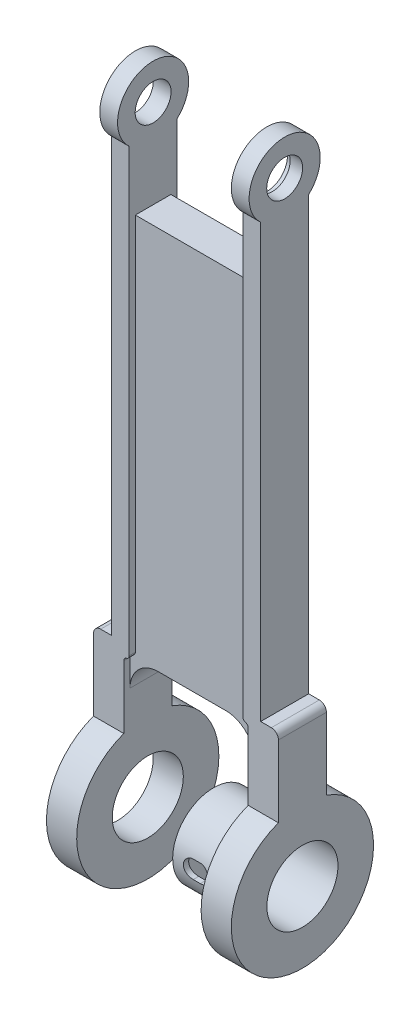
from build123d import *
from build123d.topology import SkipClean

# Parameters (mm, degrees)
SALIENTE_EXTRUIR1_DEPTH    = 10
SALIENTE_EXTRUIR2_DEPTH    = 10
SALIENTE_EXTRUIR3_DEPTH    = 10
SALIENTE_EXTRUIR4_DEPTH    = 1.75
SALIENTE_EXTRUIR5_START    = 1.75
SALIENTE_EXTRUIR5_DEPTH    = 1.75
CROQUIS26_W                = 5
CROQUIS26_H                = 35
SALIENTE_EXTRUIR6_DEPTH    = 1.75
CROQUIS27_W                = 5
CROQUIS27_H                = 35
SALIENTE_EXTRUIR7_DEPTH    = 11.75
CORTAR_EXTRUIR3_DEPTH      = 205.699932829
CORTAR_EXTRUIR3_DEPTH_BACK = 99.75
SALIENTE_EXTRUIR8_START    = -5
SALIENTE_EXTRUIR8_DEPTH    = 5
CROQUIS29_R                = 10
SALIENTE_EXTRUIR9_DEPTH    = 5
CORTAR_EXTRUIR5_DEPTH      = 206.22487666
CORTAR_EXTRUIR5_DEPTH_BACK = 206.22487666
SALIENTE_EXTRUIR11_START   = -8.5
CROQUIS32_R                = 20
SALIENTE_EXTRUIR11_DEPTH   = 8.5
CROQUIS33_R                = 20
SALIENTE_EXTRUIR12_DEPTH   = 8.5
CROQUIS34_R                = 5.05
CORTAR_EXTRUIR6_DEPTH      = 90
CROQUIS39_R                = 5.78
CORTAR_EXTRUIR7_DEPTH      = 1.5
CROQUIS41_R                = 10
CORTAR_EXTRUIR8_DEPTH      = 43
CROQUIS42_R                = 4
CORTAR_EXTRUIR9_DEPTH      = 27
CROQUIS43_R                = 10
CORTAR_EXTRUIR10_DEPTH     = 12
CROQUIS45_R                = 11.5
SALIENTE_EXTRUIR13_DEPTH   = 16.5
REDONDEO1_R                = 2
CROQUIS48_R                = 10
CORTAR_EXTRUIR12_DEPTH     = 17
SALIENTE_EXTRUIR16_DEPTH   = 6
CORTAR_EXTRUIR23_START     = -13
CORTAR_EXTRUIR23_DEPTH     = 13
SALIENTE_EXTRUIR17_START   = -25
CROQUIS54_R                = 11.5
SALIENTE_EXTRUIR17_DEPTH   = 25
CROQUIS57_R                = 10
CORTAR_EXTRUIR26_DEPTH     = 23
CROQUIS58_R                = 4
CORTAR_EXTRUIR27_DEPTH     = 23
SALIENTE_EXTRUIR18_DEPTH   = 7.5
SALIENTE_EXTRUIR18_2_DEPTH = 7.5
CORTAR_EXTRUIR28_DEPTH     = 7.5
CORTAR_EXTRUIR30_START     = -2.643019
CORTAR_EXTRUIR30_DEPTH     = 2.643019
CORTAR_EXTRUIR33_START     = -6.139862392
CORTAR_EXTRUIR33_DEPTH     = 6.139862392
CORTAR_EXTRUIR34_START     = -35.822321
CORTAR_EXTRUIR34_DEPTH     = 40


# Read off the part's stored shape, not the designer's step: Cortar-Extruir33
with BuildPart() as part:
    # Croquis1 → Saliente-Extruir1 (new body)
    with BuildSketch(Plane.XY):
        Polygon((0, -143), (0, -35), (-1.6, -35), (-37.4, -35), (-42, -35), (-42, -143), align=None)
    extrude(amount=-SALIENTE_EXTRUIR1_DEPTH)

    # Croquis3 → Saliente-Extruir2 (add)
    with BuildSketch(Plane.XY):
        with BuildLine():
            Line((-47, -141), (-47, -145))
            Line((-47, -145), (-47, -160))
            Line((-47, -160), (-47, -180))
            Line((-47, -180), (-47, -200))
            Line((-47, -200), (-38.5, -200))
            Line((-38.5, -200), (-38.5, -151))
            Line((-38.5, -151), (-38.5, -143))
            Line((-38.5, -143), (-42, -143))
            Line((-42, -143), (-42, -139))
            Line((-42, -139), (-45, -139))
            ThreePointArc((-45, -139), (-46.414213562, -139.585786438), (-47, -141))
        make_face()
        with BuildLine():
            Line((0, -143), (-11.5, -143))
            ThreePointArc((-11.5, -143), (-5.843145751, -145.343145751), (-3.5, -151))
            Line((-3.5, -151), (-3.5, -200))
            Line((-3.5, -200), (5, -200))
            Line((5, -200), (5, -143))
            Line((5, -143), (5, -141))
            ThreePointArc((5, -141), (4.414213562, -139.585786438), (3, -139))
            Line((3, -139), (0, -139))
            Line((0, -139), (0, -143))
        make_face()
    extrude(amount=-SALIENTE_EXTRUIR2_DEPTH)

    # Croquis21 → Saliente-Extruir3 (add)
    with BuildSketch(Plane.XY):
        with BuildLine():
            Line((-38.5, -143), (-38.5, -151))
            ThreePointArc((-38.5, -151), (-36.156854249, -145.343145751), (-30.5, -143))
            Line((-30.5, -143), (-38.5, -143))
        make_face()
    extrude(amount=-SALIENTE_EXTRUIR3_DEPTH)

    # Croquis22 → Saliente-Extruir4 (add)
    with BuildSketch(Plane(origin=(0, 0, -10), x_dir=(-1, 0, 0), z_dir=(0, 0, -1))):
        with BuildLine():
            Line((3.5, -200), (3.5, -156.87358131))
            Line((3.5, -156.87358131), (3.5, -151))
            Line((3.5, -151), (3.5, -141.333778868))
            ThreePointArc((3.5, -141.333778868), (3.709430585, -140.721406432), (4.25, -140.365533031))
            ThreePointArc((4.25, -140.365533031), (4.790569415, -140.00965963), (5, -139.397287194))
            Line((5, -139.397287194), (5, -35))
            Line((5, -35), (0, -35))
            Line((0, -35), (0, -139))
            Line((0, -139), (-3, -139))
            ThreePointArc((-3, -139), (-4.414213562, -139.585786438), (-5, -141))
            Line((-5, -141), (-5, -200))
            Line((-5, -200), (3.5, -200))
        make_face()
        with BuildLine():
            Line((42, -35), (37, -35))
            Line((37, -35), (37, -139.397287194))
            ThreePointArc((37, -139.397287194), (37.209430585, -140.00965963), (37.75, -140.365533031))
            ThreePointArc((37.75, -140.365533031), (38.290569415, -140.721406432), (38.5, -141.333778868))
            Line((38.5, -141.333778868), (38.5, -151))
            Line((38.5, -151), (38.5, -155.512462497))
            Line((38.5, -155.512462497), (38.5, -200))
            Line((38.5, -200), (47, -200))
            Line((47, -200), (47, -141))
            ThreePointArc((47, -141), (46.414213562, -139.585786438), (45, -139))
            Line((45, -139), (42, -139))
            Line((42, -139), (42, -35))
        make_face()
    extrude(amount=SALIENTE_EXTRUIR4_DEPTH)

    # Croquis24 → Saliente-Extruir5 (add)
    with BuildSketch(Plane.XY.offset(SALIENTE_EXTRUIR5_START)):
        with BuildLine():
            Line((-37, -141.498649254), (-37, -35))
            Line((-37, -35), (-42, -35))
            Line((-42, -35), (-42, -139))
            Line((-42, -139), (-45, -139))
            ThreePointArc((-45, -139), (-46.414213562, -139.585786438), (-47, -141))
            Line((-47, -141), (-47, -200))
            Line((-47, -200), (-38.5, -200))
            Line((-38.5, -200), (-38.5, -143.435140927))
            ThreePointArc((-38.5, -143.435140927), (-38.290569415, -142.822768491), (-37.75, -142.466895091))
            ThreePointArc((-37.75, -142.466895091), (-37.209430585, -142.11102169), (-37, -141.498649254))
        make_face()
        with BuildLine():
            Line((0, -35), (-5, -35))
            Line((-5, -35), (-5, -140.397287194))
            ThreePointArc((-5, -140.397287194), (-4.790569415, -141.00965963), (-4.25, -141.365533031))
            ThreePointArc((-4.25, -141.365533031), (-3.709430585, -141.721406432), (-3.5, -142.333778868))
            Line((-3.5, -142.333778868), (-3.5, -200))
            Line((-3.5, -200), (5, -200))
            Line((5, -200), (5, -141))
            ThreePointArc((5, -141), (4.414213562, -139.585786438), (3, -139))
            Line((3, -139), (0, -139))
            Line((0, -139), (0, -35))
        make_face()
    extrude(amount=-SALIENTE_EXTRUIR5_DEPTH)

    # Croquis26 → Saliente-Extruir6 (add)
    with BuildSketch(Plane.XY):
        with Locations((-39.5, -17.5)):
            Rectangle(CROQUIS26_W, CROQUIS26_H)
        with Locations((-2.5, -17.5)):
            Rectangle(CROQUIS26_W, CROQUIS26_H)
    extrude(amount=SALIENTE_EXTRUIR6_DEPTH)

    # Croquis27 → Saliente-Extruir7 (add)
    with BuildSketch(Plane(origin=(0, 0, 0), x_dir=(-1, 0, 0), z_dir=(0, 0, -1))):
        with Locations((2.5, -17.5)):
            Rectangle(CROQUIS27_W, CROQUIS27_H)
        with Locations((39.5, -17.5)):
            Rectangle(CROQUIS27_W, CROQUIS27_H)
    extrude(amount=SALIENTE_EXTRUIR7_DEPTH)

    # Croquis28 → Cortar-Extruir3 (cut, two sides: drawn at the far end of the back side and taken through both)
    with BuildSketch(Plane.ZY.offset(5).offset(-CORTAR_EXTRUIR3_DEPTH_BACK)):
        with BuildLine():
            ThreePointArc((-11.75, -2.621822718), (-8.62065099, -0.678471884), (-5, 0))
            Line((-5, 0), (-11.75, 0))
            Line((-11.75, 0), (-11.75, -2.621822718))
        make_face()
        with BuildLine():
            Line((1.75, -2.621822718), (1.75, 0))
            Line((1.75, 0), (-5, 0))
            ThreePointArc((-5, 0), (-1.37934901, -0.678471884), (1.75, -2.621822718))
        make_face()
    extrude(amount=CORTAR_EXTRUIR3_DEPTH + CORTAR_EXTRUIR3_DEPTH_BACK, mode=Mode.SUBTRACT)

    # Croquis28<5> → Saliente-Extruir8 (add)
    with BuildSketch(Plane.ZY.offset(5).offset(SALIENTE_EXTRUIR8_START)):
        with BuildLine():
            Line((-11.75, -17.378177282), (-11.75, -2.621822718))
            ThreePointArc((-11.75, -2.621822718), (-15, -10), (-11.75, -17.378177282))
        make_face()
        with BuildLine():
            ThreePointArc((5, -10), (4.151502609, -5.968871126), (1.75, -2.621822718))
            Line((1.75, -2.621822718), (1.75, -17.378177282))
            ThreePointArc((1.75, -17.378177282), (4.151502609, -14.031128874), (5, -10))
        make_face()
    extrude(amount=SALIENTE_EXTRUIR8_DEPTH)

    # Croquis29 → Saliente-Extruir9 (add)
    with BuildSketch(Plane(origin=(-37, 0, 0), x_dir=(0, 0, -1), z_dir=(1, 0, 0))):
        with Locations((5, -10)):
            Circle(CROQUIS29_R)
    extrude(amount=-SALIENTE_EXTRUIR9_DEPTH)

    # Croquis31 → Cortar-Extruir5 (cut, two sides: drawn at the far end of the back side and taken through both)
    with BuildSketch(Plane(origin=(-38.5, 0, 0), x_dir=(0, 0, -1), z_dir=(1, 0, 0)).offset(-CORTAR_EXTRUIR5_DEPTH_BACK)):
        with BuildLine():
            Line((-1.75, -200), (5, -200))
            ThreePointArc((5, -200), (1.574376792, -199.704443804), (-1.75, -198.826510564))
            Line((-1.75, -198.826510564), (-1.75, -200))
        make_face()
        with BuildLine():
            Line((11.75, -200), (11.75, -198.826510564))
            ThreePointArc((11.75, -198.826510564), (8.425623208, -199.704443804), (5, -200))
            Line((5, -200), (11.75, -200))
        make_face()
    extrude(amount=CORTAR_EXTRUIR5_DEPTH + CORTAR_EXTRUIR5_DEPTH_BACK, mode=Mode.SUBTRACT)

    # Croquis32 → Saliente-Extruir11 (add)
    with BuildSketch(Plane(origin=(-38.5, 0, 0), x_dir=(0, 0, -1), z_dir=(1, 0, 0)).offset(SALIENTE_EXTRUIR11_START)):
        with Locations((5, -180)):
            Circle(CROQUIS32_R)
    extrude(amount=SALIENTE_EXTRUIR11_DEPTH)

    # Croquis33 → Saliente-Extruir12 (add)
    with BuildSketch(Plane.ZY.offset(3.5)):
        with Locations((-5, -180)):
            Circle(CROQUIS33_R)
    extrude(amount=-SALIENTE_EXTRUIR12_DEPTH)

    # Croquis34 → Cortar-Extruir6 (cut)
    with BuildSketch(Plane.ZY.offset(42)):
        with Locations(Location((-5, -10, 0), (0, 0, 270))):
            Circle(CROQUIS34_R)
    extrude(amount=-CORTAR_EXTRUIR6_DEPTH, mode=Mode.SUBTRACT)

    # Croquis39 → Cortar-Extruir7 (cut)
    with SkipClean():  # the faces are left unmerged after this step: merging them gives an invalid solid
        with BuildSketch(Plane.ZY.offset(5)):
            with Locations(Location((-5, -10, 0), (0, 0, 270))):
                Circle(CROQUIS39_R)
        extrude(amount=-CORTAR_EXTRUIR7_DEPTH, mode=Mode.SUBTRACT)

    # Croquis41 → Cortar-Extruir8 (cut)
    with SkipClean():  # the faces are left unmerged after this step: merging them gives an invalid solid
        with BuildSketch(Plane(origin=(-38.5, 0, 0), x_dir=(0, 0, -1), z_dir=(1, 0, 0))):
            with Locations((5, -180)):
                Circle(CROQUIS41_R)
        extrude(amount=-CORTAR_EXTRUIR8_DEPTH, mode=Mode.SUBTRACT)

    # Croquis42 → Cortar-Extruir9 (cut)
    with SkipClean():  # the faces are left unmerged after this step: merging them gives an invalid solid
        with BuildSketch(Plane(origin=(5, 0, 0), x_dir=(0, 0, -1), z_dir=(1, 0, 0))):
            with Locations(Location((5, -180, 0), (0, 0, 90))):
                Circle(CROQUIS42_R)
        extrude(amount=-CORTAR_EXTRUIR9_DEPTH, mode=Mode.SUBTRACT)

    # Croquis43 → Cortar-Extruir10 (cut)
    with SkipClean():  # the faces are left unmerged after this step: merging them gives an invalid solid
        with BuildSketch(Plane(origin=(5, 0, 0), x_dir=(0, 0, -1), z_dir=(1, 0, 0))):
            with Locations((5, -180)):
                Circle(CROQUIS43_R)
        extrude(amount=-CORTAR_EXTRUIR10_DEPTH, mode=Mode.SUBTRACT)

    # Croquis45 → Saliente-Extruir13 (add)
    with SkipClean():  # the faces are left unmerged after this step: merging them gives an invalid solid
        with BuildSketch(Plane.ZY.offset(3.5)):
            with Locations(Location((-5, -180, 0), (0, 0, 270))):
                Circle(CROQUIS45_R)
        extrude(amount=SALIENTE_EXTRUIR13_DEPTH)

    # Redondeo1
    redondeo1_edges = [part.edges().sort_by_distance(p)[0] for p in [
        (-3.5, -168.5, -5),
    ]]
    fillet(redondeo1_edges, radius=REDONDEO1_R)

    # Croquis48 → Cortar-Extruir12 (cut)
    with SkipClean():  # the faces are left unmerged after this step: merging them gives an invalid solid
        with BuildSketch(Plane(origin=(-3.5, 0, 0), x_dir=(0, 0, -1), z_dir=(1, 0, 0))):
            with Locations((5, -180)):
                Circle(CROQUIS48_R)
        extrude(amount=-CORTAR_EXTRUIR12_DEPTH, mode=Mode.SUBTRACT)

    # Croquis54 → Saliente-Extruir17 (add)
    with SkipClean():  # the faces are left unmerged after this step: merging them gives an invalid solid
        with BuildSketch(Plane.ZY.offset(20).offset(SALIENTE_EXTRUIR17_START)):
            with Locations(Location((-5, -180, 0), (0, 0, 270))):
                Circle(CROQUIS54_R)
        extrude(amount=SALIENTE_EXTRUIR17_DEPTH)

    # Croquis57 → Cortar-Extruir26 (cut)
    with SkipClean():  # the faces are left unmerged after this step: merging them gives an invalid solid
        with BuildSketch(Plane(origin=(5, 0, 0), x_dir=(0, 0, -1), z_dir=(1, 0, 0))):
            with Locations((5, -180)):
                Circle(CROQUIS57_R)
        extrude(amount=-CORTAR_EXTRUIR26_DEPTH, mode=Mode.SUBTRACT)

    # Croquis58 → Cortar-Extruir27 (cut)
    with SkipClean():  # the faces are left unmerged after this step: merging them gives an invalid solid
        with BuildSketch(Plane.ZY.offset(20)):
            with Locations(Location((-5, -180, 0), (0, 0, 270))):
                Circle(CROQUIS58_R)
        extrude(amount=-CORTAR_EXTRUIR27_DEPTH, mode=Mode.SUBTRACT)


with BuildPart() as body_2:
    # Croquis50 → Saliente-Extruir16 (new body)
    with BuildSketch(Plane.ZY.offset(20)):
        with BuildLine():
            ThreePointArc((-16.101801656, -183), (-16.400015768, -181.513155802), (-16.5, -180))
            Line((-16.5, -180), (-16.5, -183))
            Line((-16.5, -183), (-16.101801656, -183))
        make_face()
        with BuildLine():
            Line((-16.5, -176.344003647), (-16.5, -180))
            ThreePointArc((-16.5, -180), (-16.349864922, -178.147821214), (-15.903379782, -176.344003647))
            Line((-15.903379782, -176.344003647), (-16.5, -176.344003647))
        make_face()
        Polygon((-17.164048231, -176.344003647), (-17.164048231, -183), (-16.5, -183), (-16.5, -180), (-16.5, -176.344003647), align=None)
    extrude(amount=-SALIENTE_EXTRUIR16_DEPTH)

    # Croquis52 → Cortar-Extruir23 (cut)
    with BuildSketch(Plane.ZY.offset(20).offset(CORTAR_EXTRUIR23_START)):
        with BuildLine():
            Line((-17.164048231, -183), (-16.101801656, -183))
            ThreePointArc((-16.101801656, -183), (-16.494893405, -179.657325791), (-15.903379782, -176.344003647))
            Line((-15.903379782, -176.344003647), (-17.164048231, -176.344003647))
            Line((-17.164048231, -176.344003647), (-17.164048231, -183))
        make_face()
    extrude(amount=CORTAR_EXTRUIR23_DEPTH, mode=Mode.SUBTRACT)


with BuildPart() as body_2_2:
    # Croquis62 → Saliente-Extruir18 (new body)
    with BuildSketch(Plane.ZY.offset(20)):
        Polygon((10.822320598, -182.5), (10.822320598, -177.5), (6.5, -177.5), (6.5, -180), (6.5, -182.5), align=None)
    extrude(amount=-SALIENTE_EXTRUIR18_DEPTH)


with BuildPart() as body_3:
    # Croquis62 → Saliente-Extruir18 2 (new body)
    with BuildSketch(Plane.ZY.offset(20)):
        Polygon((-7.5, -194.143018627), (-2.5, -194.143018627), (-2.5, -191.5), (-5, -191.5), (-7.5, -191.5), align=None)
    extrude(amount=-SALIENTE_EXTRUIR18_2_DEPTH)


with BuildPart() as cortar_extruir28_tool:
    # Croquis63 → Cortar-Extruir28 (new body)
    with SkipClean():  # the faces are left unmerged after this step: merging them gives an invalid solid
        with BuildSketch(Plane.XZ.offset(194.143018627)):
            with BuildLine():
                Line((-14.5, -2.5), (-12.5, -2.5))
                ThreePointArc((-12.5, -2.5), (-10, -5), (-12.5, -7.5))
                Line((-12.5, -7.5), (-14.5, -7.5))
                ThreePointArc((-14.5, -7.5), (-17, -5), (-14.5, -2.5))
            make_face()
        extrude(amount=-CORTAR_EXTRUIR28_DEPTH)


with BuildPart() as part_1:
    with SkipClean():  # the faces are left unmerged after this step: merging them gives an invalid solid
        add(part.part)

        # Cortar-Extruir28: cut by cortar_extruir28_tool
        add(cortar_extruir28_tool.part, mode=Mode.SUBTRACT)


with BuildPart() as body_3_1:
    with SkipClean():  # the faces are left unmerged after this step: merging them gives an invalid solid
        add(body_3.part)

        # Cortar-Extruir28: cut by cortar_extruir28_tool
        add(cortar_extruir28_tool.part, mode=Mode.SUBTRACT)

    # Croquis64 → Cortar-Extruir30 (cut)
    with BuildSketch(Plane.XZ.offset(194.143018627).offset(CORTAR_EXTRUIR30_START)):
        with BuildLine():
            Line((-14.5, -2.5), (-20, -2.5))
            Line((-20, -2.5), (-20, -7.5))
            Line((-20, -7.5), (-14.5, -7.5))
            ThreePointArc((-14.5, -7.5), (-17, -5), (-14.5, -2.5))
        make_face()
    extrude(amount=CORTAR_EXTRUIR30_DEPTH, mode=Mode.SUBTRACT)


with BuildPart() as cortar_extruir33_tool:
    # Cortar-Extruir33 outline → Cortar-Extruir33 (new body)
    with SkipClean():  # the faces are left unmerged after this step: merging them gives an invalid solid
        with BuildSketch(Plane.XY.offset(10.822320598).offset(CORTAR_EXTRUIR33_START)):
            with BuildLine():
                ThreePointArc((-12.5, -182.5), (-10, -180), (-12.5, -177.5))
                Line((-12.5, -177.5), (-14.5, -177.5))
                ThreePointArc((-14.5, -177.5), (-17, -180), (-14.5, -182.5))
                Line((-14.5, -182.5), (-12.5, -182.5))
            make_face()
        extrude(amount=CORTAR_EXTRUIR33_DEPTH)


with BuildPart() as part_2:
    with SkipClean():  # the faces are left unmerged after this step: merging them gives an invalid solid
        add(part_1.part)

        # Cortar-Extruir33: cut by cortar_extruir33_tool
        add(cortar_extruir33_tool.part, mode=Mode.SUBTRACT)


with BuildPart() as body_2_2_1:
    with SkipClean():  # the faces are left unmerged after this step: merging them gives an invalid solid
        add(body_2_2.part)

        # Cortar-Extruir33: cut by cortar_extruir33_tool
        add(cortar_extruir33_tool.part, mode=Mode.SUBTRACT)

    # Croquis67 → Cortar-Extruir34 (cut)
    with BuildSketch(Plane.XY.offset(10.822320598).offset(CORTAR_EXTRUIR34_START)):
        with BuildLine():
            Line((-14.5, -177.5), (-20, -177.5))
            Line((-20, -177.5), (-20, -182.5))
            Line((-20, -182.5), (-14.5, -182.5))
            ThreePointArc((-14.5, -182.5), (-17, -180), (-14.5, -177.5))
        make_face()
    extrude(amount=CORTAR_EXTRUIR34_DEPTH, mode=Mode.SUBTRACT)


solid = part_2.part
